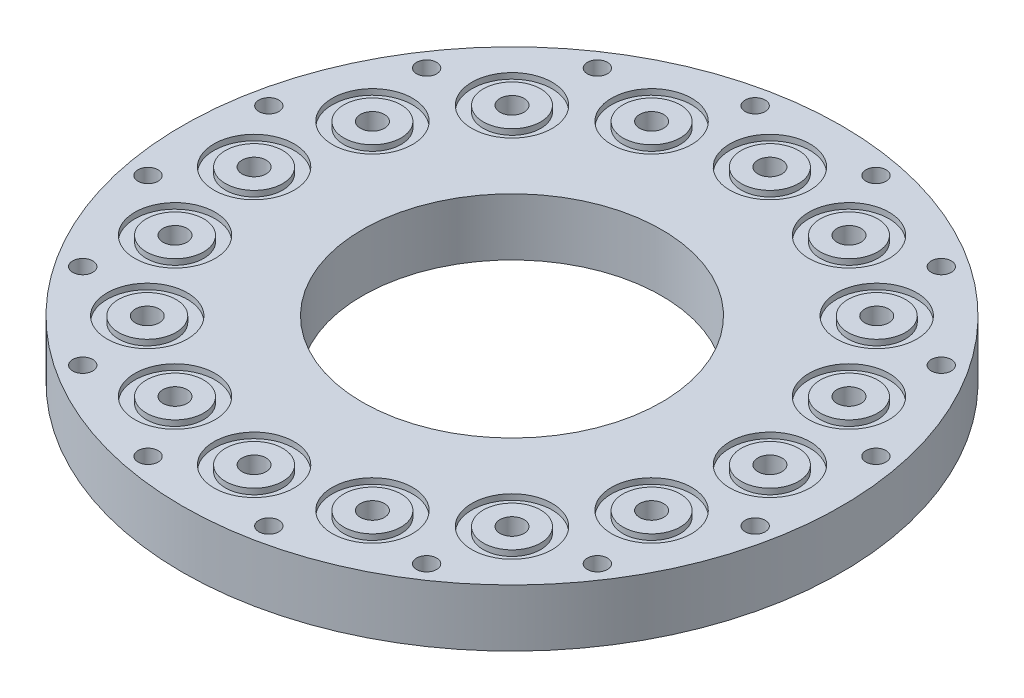
from build123d import *

# Parameters (mm, degrees)
SKETCH1_R           = 57.5
SKETCH1_R_2         = 1.75
SKETCH1_R_3         = 26.1
SKETCH1_R_4         = 2.1
BOSS_EXTRUDE1_DEPTH = 10
SKETCH2_R           = 7
SKETCH2_R_2         = 5
CUT_EXTRUDE1_DEPTH  = 1


with BuildPart() as part:
    # Sketch1 → Boss-Extrude1 (new body)
    with BuildSketch(Plane(origin=(0, 0, 0), x_dir=(1, 0, 0), z_dir=(0, 1, 0))):
        Circle(SKETCH1_R)
        with Locations((-10.534877389, 52.962405142)):
            Circle(SKETCH1_R_2, mode=Mode.SUBTRACT)
        with Locations((10.534877389, 52.962405142)):
            Circle(SKETCH1_R_2, mode=Mode.SUBTRACT)
        with Locations((30.000792583, 44.899359064)):
            Circle(SKETCH1_R_2, mode=Mode.SUBTRACT)
        with Locations((44.899359064, 30.000792583)):
            Circle(SKETCH1_R_2, mode=Mode.SUBTRACT)
        with Locations((52.962405142, 10.534877389)):
            Circle(SKETCH1_R_2, mode=Mode.SUBTRACT)
        with Locations((52.962405142, -10.534877389)):
            Circle(SKETCH1_R_2, mode=Mode.SUBTRACT)
        with Locations((44.899359064, -30.000792583)):
            Circle(SKETCH1_R_2, mode=Mode.SUBTRACT)
        with Locations((30.000792583, -44.899359064)):
            Circle(SKETCH1_R_2, mode=Mode.SUBTRACT)
        with Locations((10.534877389, -52.962405142)):
            Circle(SKETCH1_R_2, mode=Mode.SUBTRACT)
        with Locations((-10.534877389, -52.962405142)):
            Circle(SKETCH1_R_2, mode=Mode.SUBTRACT)
        with Locations((-30.000792583, -44.899359064)):
            Circle(SKETCH1_R_2, mode=Mode.SUBTRACT)
        with Locations((-44.899359064, -30.000792583)):
            Circle(SKETCH1_R_2, mode=Mode.SUBTRACT)
        Circle(SKETCH1_R_3, mode=Mode.SUBTRACT)
        with Locations((0, 45)):
            Circle(SKETCH1_R_4, mode=Mode.SUBTRACT)
        with Locations((17.220754456, 41.574578963)):
            Circle(SKETCH1_R_4, mode=Mode.SUBTRACT)
        with Locations((31.819805153, 31.819805153)):
            Circle(SKETCH1_R_4, mode=Mode.SUBTRACT)
        with Locations((41.574578963, 17.220754456)):
            Circle(SKETCH1_R_4, mode=Mode.SUBTRACT)
        with Locations((45, 0)):
            Circle(SKETCH1_R_4, mode=Mode.SUBTRACT)
        with Locations((41.574578963, -17.220754456)):
            Circle(SKETCH1_R_4, mode=Mode.SUBTRACT)
        with Locations((31.819805153, -31.819805153)):
            Circle(SKETCH1_R_4, mode=Mode.SUBTRACT)
        with Locations((17.220754456, -41.574578963)):
            Circle(SKETCH1_R_4, mode=Mode.SUBTRACT)
        with Locations((0, -45)):
            Circle(SKETCH1_R_4, mode=Mode.SUBTRACT)
        with Locations((-17.220754456, -41.574578963)):
            Circle(SKETCH1_R_4, mode=Mode.SUBTRACT)
        with Locations((-31.819805153, -31.819805153)):
            Circle(SKETCH1_R_4, mode=Mode.SUBTRACT)
        with Locations((-41.574578963, -17.220754456)):
            Circle(SKETCH1_R_4, mode=Mode.SUBTRACT)
        with Locations((-45, 0)):
            Circle(SKETCH1_R_4, mode=Mode.SUBTRACT)
        with Locations((-41.574578963, 17.220754456)):
            Circle(SKETCH1_R_4, mode=Mode.SUBTRACT)
        with Locations((-31.819805153, 31.819805153)):
            Circle(SKETCH1_R_4, mode=Mode.SUBTRACT)
        with Locations((-17.220754456, 41.574578963)):
            Circle(SKETCH1_R_4, mode=Mode.SUBTRACT)
        with Locations((-52.962405142, -10.534877389)):
            Circle(SKETCH1_R_2, mode=Mode.SUBTRACT)
        with Locations((-52.962405142, 10.534877389)):
            Circle(SKETCH1_R_2, mode=Mode.SUBTRACT)
        with Locations((-44.899359064, 30.000792583)):
            Circle(SKETCH1_R_2, mode=Mode.SUBTRACT)
        with Locations((-30.000792583, 44.899359064)):
            Circle(SKETCH1_R_2, mode=Mode.SUBTRACT)
    extrude(amount=BOSS_EXTRUDE1_DEPTH)

    # Sketch2 → Cut-Extrude1 (cut)
    # profile 1 of 16: a face of its own
    with BuildSketch(Plane(origin=(0, 10, 0), x_dir=(1, 0, 0), z_dir=(0, 1, 0))):
        with Locations((0, 45)):
            Circle(SKETCH2_R)
        with Locations((0, 45)):
            Circle(SKETCH2_R_2, mode=Mode.SUBTRACT)
    # profile 2 of 16: a face of its own
    with BuildSketch(Plane(origin=(0, 10, 0), x_dir=(1, 0, 0), z_dir=(0, 1, 0))):
        with Locations((17.220754456, 41.574578963)):
            Circle(SKETCH2_R)
        with Locations((17.220754456, 41.574578963)):
            Circle(SKETCH2_R_2, mode=Mode.SUBTRACT)
    # profile 3 of 16: a face of its own
    with BuildSketch(Plane(origin=(0, 10, 0), x_dir=(1, 0, 0), z_dir=(0, 1, 0))):
        with Locations((31.819805153, 31.819805153)):
            Circle(SKETCH2_R)
        with Locations((31.819805153, 31.819805153)):
            Circle(SKETCH2_R_2, mode=Mode.SUBTRACT)
    # profile 4 of 16: a face of its own
    with BuildSketch(Plane(origin=(0, 10, 0), x_dir=(1, 0, 0), z_dir=(0, 1, 0))):
        with Locations((41.574578963, 17.220754456)):
            Circle(SKETCH2_R)
        with Locations((41.574578963, 17.220754456)):
            Circle(SKETCH2_R_2, mode=Mode.SUBTRACT)
    # profile 5 of 16: a face of its own
    with BuildSketch(Plane(origin=(0, 10, 0), x_dir=(1, 0, 0), z_dir=(0, 1, 0))):
        with Locations((45, 0)):
            Circle(SKETCH2_R)
        with Locations((45, 0)):
            Circle(SKETCH2_R_2, mode=Mode.SUBTRACT)
    # profile 6 of 16: a face of its own
    with BuildSketch(Plane(origin=(0, 10, 0), x_dir=(1, 0, 0), z_dir=(0, 1, 0))):
        with Locations((41.574578963, -17.220754456)):
            Circle(SKETCH2_R)
        with Locations((41.574578963, -17.220754456)):
            Circle(SKETCH2_R_2, mode=Mode.SUBTRACT)
    # profile 7 of 16: a face of its own
    with BuildSketch(Plane(origin=(0, 10, 0), x_dir=(1, 0, 0), z_dir=(0, 1, 0))):
        with Locations((31.819805153, -31.819805153)):
            Circle(SKETCH2_R)
        with Locations((31.819805153, -31.819805153)):
            Circle(SKETCH2_R_2, mode=Mode.SUBTRACT)
    # profile 8 of 16: a face of its own
    with BuildSketch(Plane(origin=(0, 10, 0), x_dir=(1, 0, 0), z_dir=(0, 1, 0))):
        with Locations((17.220754456, -41.574578963)):
            Circle(SKETCH2_R)
        with Locations((17.220754456, -41.574578963)):
            Circle(SKETCH2_R_2, mode=Mode.SUBTRACT)
    # profile 9 of 16: a face of its own
    with BuildSketch(Plane(origin=(0, 10, 0), x_dir=(1, 0, 0), z_dir=(0, 1, 0))):
        with Locations((0, -45)):
            Circle(SKETCH2_R)
        with Locations((0, -45)):
            Circle(SKETCH2_R_2, mode=Mode.SUBTRACT)
    # profile 10 of 16: a face of its own
    with BuildSketch(Plane(origin=(0, 10, 0), x_dir=(1, 0, 0), z_dir=(0, 1, 0))):
        with Locations((-17.220754456, -41.574578963)):
            Circle(SKETCH2_R)
        with Locations((-17.220754456, -41.574578963)):
            Circle(SKETCH2_R_2, mode=Mode.SUBTRACT)
    # profile 11 of 16: a face of its own
    with BuildSketch(Plane(origin=(0, 10, 0), x_dir=(1, 0, 0), z_dir=(0, 1, 0))):
        with Locations((-31.819805153, -31.819805153)):
            Circle(SKETCH2_R)
        with Locations((-31.819805153, -31.819805153)):
            Circle(SKETCH2_R_2, mode=Mode.SUBTRACT)
    # profile 12 of 16: a face of its own
    with BuildSketch(Plane(origin=(0, 10, 0), x_dir=(1, 0, 0), z_dir=(0, 1, 0))):
        with Locations((-41.574578963, -17.220754456)):
            Circle(SKETCH2_R)
        with Locations((-41.574578963, -17.220754456)):
            Circle(SKETCH2_R_2, mode=Mode.SUBTRACT)
    # profile 13 of 16: a face of its own
    with BuildSketch(Plane(origin=(0, 10, 0), x_dir=(1, 0, 0), z_dir=(0, 1, 0))):
        with Locations((-45, 0)):
            Circle(SKETCH2_R)
        with Locations((-45, 0)):
            Circle(SKETCH2_R_2, mode=Mode.SUBTRACT)
    # profile 14 of 16: a face of its own
    with BuildSketch(Plane(origin=(0, 10, 0), x_dir=(1, 0, 0), z_dir=(0, 1, 0))):
        with Locations((-41.574578963, 17.220754456)):
            Circle(SKETCH2_R)
        with Locations((-41.574578963, 17.220754456)):
            Circle(SKETCH2_R_2, mode=Mode.SUBTRACT)
    # profile 15 of 16: a face of its own
    with BuildSketch(Plane(origin=(0, 10, 0), x_dir=(1, 0, 0), z_dir=(0, 1, 0))):
        with Locations((-31.819805153, 31.819805153)):
            Circle(SKETCH2_R)
        with Locations((-31.819805153, 31.819805153)):
            Circle(SKETCH2_R_2, mode=Mode.SUBTRACT)
    # profile 16 of 16: a face of its own
    with BuildSketch(Plane(origin=(0, 10, 0), x_dir=(1, 0, 0), z_dir=(0, 1, 0))):
        with Locations((-17.220754456, 41.574578963)):
            Circle(SKETCH2_R)
        with Locations((-17.220754456, 41.574578963)):
            Circle(SKETCH2_R_2, mode=Mode.SUBTRACT)
    extrude(amount=-CUT_EXTRUDE1_DEPTH, mode=Mode.SUBTRACT)


solid = part.part
